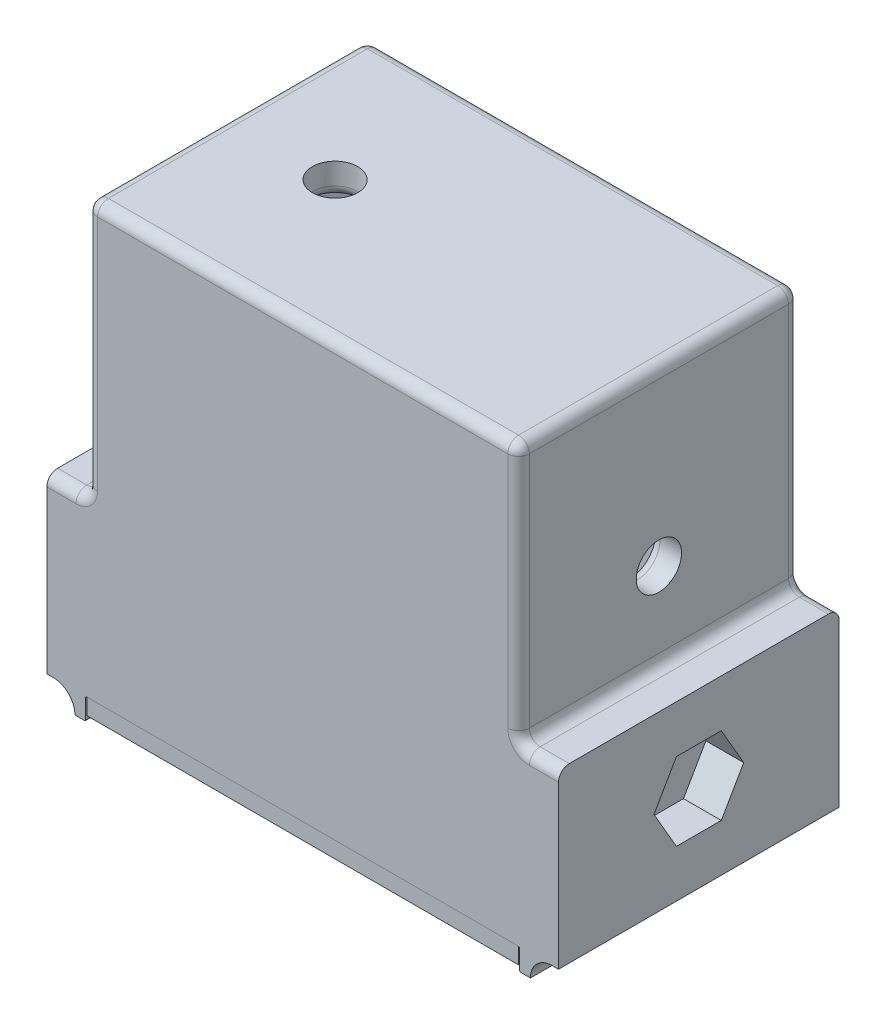
from build123d import *

# Parameters (mm, degrees)
SKETCH1_W               = 40
SKETCH1_H               = 26
BODY_DEPTH              = 40
SKETCH2_W               = 3.7
SKETCH2_H               = 26
EXTENSION_DEPTH         = 16
SKETCH5_W               = 34
SKETCH5_H               = 20
CAVITY_DEPTH            = 37
TOP_HOLE_REACH          = 50.277
SKETCH6_R               = 2.1
SIDE_HOLE_REACH         = 62.652
SKETCH7_R               = 2.1
SKETCH3_W               = 1
SKETCH3_H               = 26
LEGS_DEPTH              = 2
MOUNT_COUNTERBORE_DEPTH = 3.5
F_2MM_LEG_FILLET_R      = 2
F_0_1MM_LEG_FILLET_R    = 0.1
OUTER_BOUNDARY_FILLET_R = 1
INNER_BOUNDARY_FILLET_R = 1
SKETCH8_W               = 40
SKETCH8_H               = 26
BOSS_EXTRUDE1_DEPTH     = 1.5


with BuildPart() as part:
    # Sketch1 → Body (new body)
    with BuildSketch(Plane(origin=(0, 0, 0), x_dir=(1, 0, 0), z_dir=(0, 1, 0))):
        Rectangle(SKETCH1_W, SKETCH1_H)
    extrude(amount=BODY_DEPTH)

    # Sketch2 → Extension (add)
    with BuildSketch(Plane(origin=(0, 0, 0), x_dir=(1, 0, 0), z_dir=(0, 1, 0))):
        with Locations((-21.85, 0)):
            Rectangle(SKETCH2_W, SKETCH2_H)
        with Locations((21.85, 0)):
            Rectangle(SKETCH2_W, SKETCH2_H)
    extrude(amount=EXTENSION_DEPTH)

    # Sketch5 → Cavity (cut)
    with BuildSketch(Plane(origin=(0, 0, 0), x_dir=(1, 0, 0), z_dir=(0, 1, 0))):
        Rectangle(SKETCH5_W, SKETCH5_H)
    extrude(amount=CAVITY_DEPTH, mode=Mode.SUBTRACT)

    # Sketch6 → Top Hole (cut, up to next)
    with BuildSketch(Plane(origin=(0, 40, 0), x_dir=(1, 0, 0), z_dir=(0, 1, 0)), mode=Mode.PRIVATE) as top_hole_sk1:
        with Locations(Location((-10, 0, 0), (0, 0, 270))):
            Circle(SKETCH6_R)
    top_hole_tool1 = extrude(top_hole_sk1.sketch, amount=-TOP_HOLE_REACH, mode=Mode.PRIVATE) & part.part
    add(top_hole_tool1.solids().sort_by_distance((-10, 40, 0))[0], mode=Mode.SUBTRACT)

    # Sketch7 → Side Hole (cut, up to next)
    with BuildSketch(Plane(origin=(20, 0, 0), x_dir=(0, 0, -1), z_dir=(1, 0, 0)), mode=Mode.PRIVATE) as side_hole_sk1:
        with Locations((0, 24)):
            Circle(SKETCH7_R)
    side_hole_tool1 = extrude(side_hole_sk1.sketch, amount=-SIDE_HOLE_REACH, mode=Mode.PRIVATE) & part.part
    add(side_hole_tool1.solids().sort_by_distance((20, 24, 0))[0], mode=Mode.SUBTRACT)

    # Sketch3 → Legs (add)
    with BuildSketch(Plane(origin=(0, 0, 0), x_dir=(1, 0, 0), z_dir=(0, 1, 0))):
        with Locations((-20.6, 0)):
            Rectangle(SKETCH3_W, SKETCH3_H)
        with Locations((20.6, 0)):
            Rectangle(SKETCH3_W, SKETCH3_H)
    extrude(amount=-LEGS_DEPTH)

    # Sketch4 → Mount Counterbore (cut)
    with BuildSketch(Plane.ZY.offset(23.7)):
        Polygon((2.078460969, 11.6), (-2.078460969, 11.6), (-4.156921938, 8), (-2.078460969, 4.4), (2.078460969, 4.4), (4.156921938, 8), align=None)
    mount_counterbore = extrude(amount=-MOUNT_COUNTERBORE_DEPTH, mode=Mode.SUBTRACT)

    # Mount Counterbore Mirror: Mount Counterbore across plane
    add(mount_counterbore.mirror(Plane(origin=(0, 0, 0), x_dir=(0, 0, 1), z_dir=(1, 0, 0))), mode=Mode.SUBTRACT)

    # 2mm Leg Fillet
    f_2mm_leg_fillet_edges = [part.edges().sort_by_distance(p)[0] for p in [
        (21.1, 0, 0),
        (-21.1, 0, 0),
    ]]
    fillet(f_2mm_leg_fillet_edges, radius=F_2MM_LEG_FILLET_R - 0.0001)  # a hair under: the kernel refuses the full size

    # 0.1mm Leg Fillet
    f_0_1mm_leg_fillet_edges = [part.edges().sort_by_distance(p)[0] for p in [
        (-20.1, -2, 0),
        (-20.1, 0, 0),
        (20.1, -2, 0),
        (20.1, 0, 0),
    ]]
    fillet(f_0_1mm_leg_fillet_edges, radius=F_0_1MM_LEG_FILLET_R)

    # Outer Boundary Fillet
    outer_boundary_fillet_edges = [part.edges().sort_by_distance(p)[0] for p in [
        (20, 40, 0),
        (-20, 16, 0),
        (-21.85, 16, -13),
        (0, 40, -13),
        (-21.85, 16, 13),
        (20, 16, 0),
        (21.85, 16, 13),
        (21.85, 16, -13),
        (-20, 40, 0),
        (-20, 28, -13),
        (20, 28, -13),
        (20, 28, 13),
        (-20, 28, 13),
        (0, 40, 13),
    ]]
    fillet(outer_boundary_fillet_edges, radius=OUTER_BOUNDARY_FILLET_R)

    # Inner Boundary Fillet
    inner_boundary_fillet_edges = [part.edges().sort_by_distance(p)[0] for p in [
        (-17, 18.5, -10),
        (-17, 18.5, 10),
        (17, 18.5, 10),
        (17, 18.5, -10),
        (-17, 37, 0),
        (0, 37, 10),
        (17, 37, 0),
        (0, 37, -10),
        (-10, 37, -2.1),
        (17, 24, 2.1),
    ]]
    fillet(inner_boundary_fillet_edges, radius=INNER_BOUNDARY_FILLET_R)


with BuildPart() as body_2:
    # Sketch8 → Boss-Extrude1 (new body)
    with BuildSketch(Plane.XZ):
        Rectangle(SKETCH8_W, SKETCH8_H)
        with BuildLine():
            Line((-16, -10), (16, -10))
            ThreePointArc((16, -10), (16.707106781, -9.707106781), (17, -9))
            Line((17, -9), (17, 9))
            ThreePointArc((17, 9), (16.707106781, 9.707106781), (16, 10))
            Line((16, 10), (-16, 10))
            ThreePointArc((-16, 10), (-16.707106781, 9.707106781), (-17, 9))
            Line((-17, 9), (-17, -9))
            ThreePointArc((-17, -9), (-16.707106781, -9.707106781), (-16, -10))
        make_face(mode=Mode.SUBTRACT)
    extrude(amount=BOSS_EXTRUDE1_DEPTH)


solid = Compound([part.part, body_2.part])
